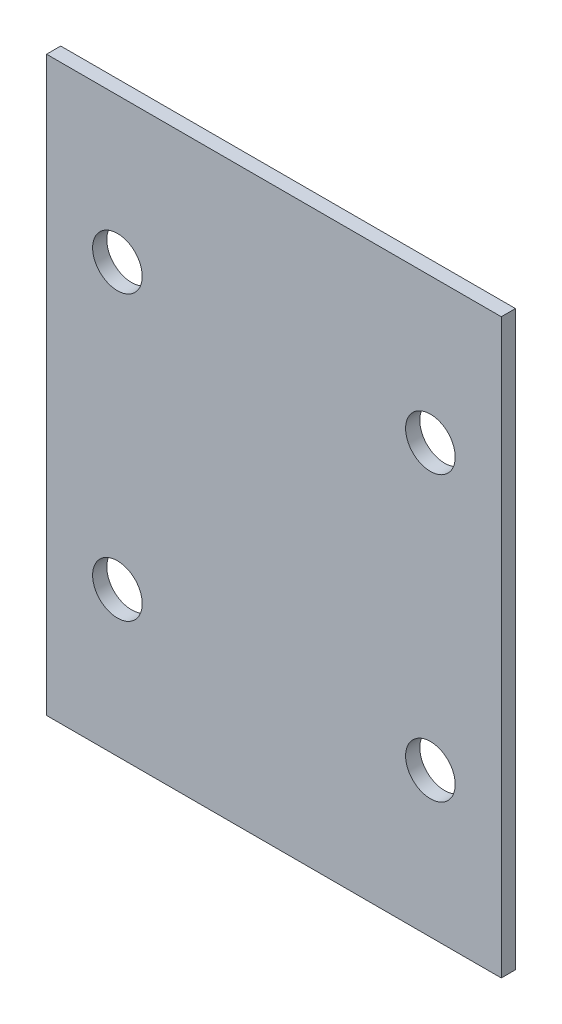
from build123d import *

# Parameters (mm, degrees)
SKETCH1_W           = 203.708
SKETCH1_H           = 256.54
BOSS_EXTRUDE1_DEPTH = 6.35
CUT_EXTRUDE1_REACH  = 326.339
SKETCH2_R           = 11.1125


with BuildPart() as part:
    # Sketch1 → Boss-Extrude1 (new body)
    with BuildSketch(Plane.XY):
        with Locations((81.646636302, 139.093604852)):
            Rectangle(SKETCH1_W, SKETCH1_H)
    extrude(amount=BOSS_EXTRUDE1_DEPTH)

    # Sketch2 → Cut-Extrude1 (cut, up to next)
    with BuildSketch(Plane(origin=(0, 0, 0), x_dir=(-1, 0, 0), z_dir=(0, 0, -1)), mode=Mode.PRIVATE) as cut_extrude1_sk1:
        with Locations((-151.750636302, 202.593604852)):
            Circle(SKETCH2_R)
    cut_extrude1_tool1 = extrude(cut_extrude1_sk1.sketch, amount=-CUT_EXTRUDE1_REACH, mode=Mode.PRIVATE) & part.part
    # Sketch2 → Cut-Extrude1 (cut, up to next)
    with BuildSketch(Plane(origin=(0, 0, 0), x_dir=(-1, 0, 0), z_dir=(0, 0, -1)), mode=Mode.PRIVATE) as cut_extrude1_sk2:
        with Locations((-151.750636302, 75.593604852)):
            Circle(SKETCH2_R)
    cut_extrude1_tool2 = extrude(cut_extrude1_sk2.sketch, amount=-CUT_EXTRUDE1_REACH, mode=Mode.PRIVATE) & part.part
    # Sketch2 → Cut-Extrude1 (cut, up to next)
    with BuildSketch(Plane(origin=(0, 0, 0), x_dir=(-1, 0, 0), z_dir=(0, 0, -1)), mode=Mode.PRIVATE) as cut_extrude1_sk3:
        with Locations((-11.542636302, 202.593604852)):
            Circle(SKETCH2_R)
    cut_extrude1_tool3 = extrude(cut_extrude1_sk3.sketch, amount=-CUT_EXTRUDE1_REACH, mode=Mode.PRIVATE) & part.part
    # Sketch2 → Cut-Extrude1 (cut, up to next)
    with BuildSketch(Plane(origin=(0, 0, 0), x_dir=(-1, 0, 0), z_dir=(0, 0, -1)), mode=Mode.PRIVATE) as cut_extrude1_sk4:
        with Locations((-11.542636302, 75.593604852)):
            Circle(SKETCH2_R)
    cut_extrude1_tool4 = extrude(cut_extrude1_sk4.sketch, amount=-CUT_EXTRUDE1_REACH, mode=Mode.PRIVATE) & part.part
    add(cut_extrude1_tool1.solids().sort_by_distance((151.750636, 202.593605, 0))[0], mode=Mode.SUBTRACT)
    add(cut_extrude1_tool2.solids().sort_by_distance((151.750636, 75.593605, 0))[0], mode=Mode.SUBTRACT)
    add(cut_extrude1_tool3.solids().sort_by_distance((11.542636, 202.593605, 0))[0], mode=Mode.SUBTRACT)
    add(cut_extrude1_tool4.solids().sort_by_distance((11.542636, 75.593605, 0))[0], mode=Mode.SUBTRACT)


solid = part.part
